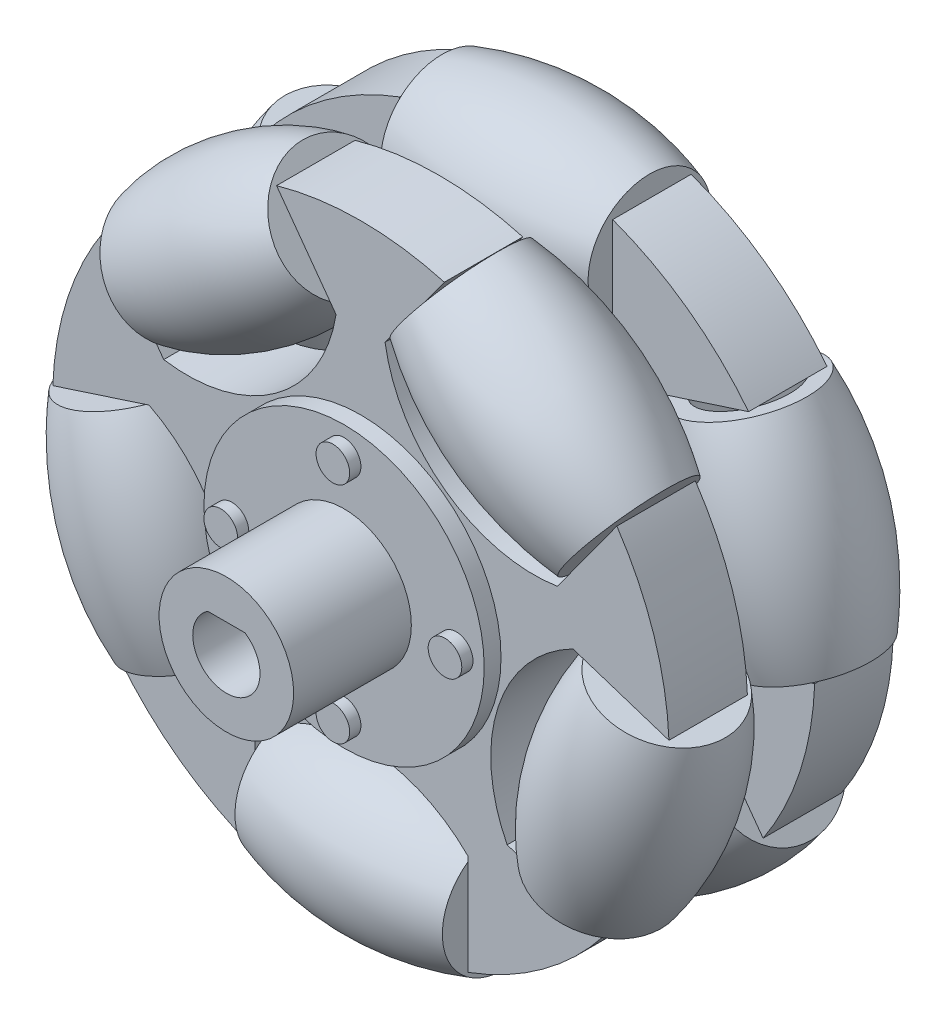
from build123d import *

# Parameters (mm, degrees)
BOSS_EXTRUDE2_DEPTH      = 3.5
BOSS_EXTRUDE5_DEPTH      = 3.5
BOSS_EXTRUDE6_DEPTH      = 5
BOSS_EXTRUDE6_DEPTH_BACK = 1
SKETCH3_30_R             = 12.5
SKETCH6_R                = 12.5
CUT_EXTRUDE3_DEPTH       = 2
BOSS_EXTRUDE9_DEPTH      = 6
BOSS_EXTRUDE9_DEPTH_BACK = 16
SKETCH3_33_R             = 1.5
SKETCH10_R               = 6
BOSS_EXTRUDE10_DEPTH     = 12
CUT_EXTRUDE4_DEPTH       = 51.813384178
CUT_EXTRUDE4_DEPTH_BACK  = 51.813384178
SKETCH11_R               = 6
CUT_EXTRUDE5_DEPTH       = 15


# Read off the part's stored shape, not the designer's step: moBlkMgr[Onmi_58mm_OK]
with BuildPart() as part:
    # Sketch1 → Revolve3 (revolve)
    with BuildSketch(Plane.XY, mode=Mode.PRIVATE) as revolve3_sk:
        with BuildLine():
            Line((27.488521747, -0.794463438), (28.998407922, -0.303871681))
            ThreePointArc((28.998407922, -0.303871681), (27.580638973, 8.961492837), (23.281593526, 17.29067387))
            Line((23.281593526, 17.29067387), (21.771707351, 16.800082113))
            ThreePointArc((21.771707351, 16.800082113), (26.028560776, 8.874909798), (27.5, 0))
            ThreePointArc((27.5, 0), (27.497130287, -0.397273176), (27.488521747, -0.794463438))
        make_face()
    revolve(revolve3_sk.sketch.rotate(Axis((18.064836163, 15.595646653, 0), (0.30901699437493513, -0.9510565162951576, 0)), 180), axis=Axis((18.064836163, 15.595646653, 0), (0.30901699437493513, -0.9510565162951576, 0)))



with BuildPart() as body_2:
    # Sketch1<6> → Revolve4 (revolve)
    with BuildSketch(Plane.XY, mode=Mode.PRIVATE) as revolve4_sk:
        with BuildLine():
            Line((-9.25, 27.485223303), (-9.25, 22.000000003))
            Line((-9.25, 22.000000003), (9.25, 22.000000003))
            Line((9.25, 22.000000003), (9.25, 27.485223303))
            ThreePointArc((9.25, 27.485223303), (0, 29), (-9.25, 27.485223303))
        make_face()
    revolve(revolve4_sk.sketch.rotate(Axis((-9.25, 22.000000003, 0), (1, 0, 0)), 90), axis=Axis((-9.25, 22.000000003, 0), (1, 0, 0)))


with BuildPart() as body_3:
    # Sketch1<7> → Revolve5 (revolve)
    with BuildSketch(Plane.XY, mode=Mode.PRIVATE) as revolve5_sk:
        with BuildLine():
            Line((-23.281593526, 17.29067387), (-18.064836163, 15.595646653))
            Line((-18.064836163, 15.595646653), (-23.781650559, -1.998898899))
            Line((-23.781650559, -1.998898899), (-28.998407922, -0.303871681))
            ThreePointArc((-28.998407922, -0.303871681), (-27.580638973, 8.961492837), (-23.281593526, 17.29067387))
        make_face()
    revolve(revolve5_sk.sketch.rotate(Axis((-23.781650559, -1.998898899, 0), (0.3090169943749596, 0.9510565162951496, 0)), 180), axis=Axis((-23.781650559, -1.998898899, 0), (0.3090169943749596, 0.9510565162951496, 0)))


with BuildPart() as body_4:
    # Sketch1<8> → Revolve6 (revolve)
    with BuildSketch(Plane.XY, mode=Mode.PRIVATE) as revolve6_sk:
        with BuildLine():
            Line((-23.638816111, -16.798999162), (-20.41468275, -12.361360295))
            Line((-20.41468275, -12.361360295), (-5.447868354, -23.235387462))
            Line((-5.447868354, -23.235387462), (-8.672001715, -27.67302633))
            ThreePointArc((-8.672001715, -27.67302633), (-17.045772316, -23.461492837), (-23.638816111, -16.798999162))
        make_face()
    revolve(revolve6_sk.sketch.rotate(Axis((-5.447868354, -23.235387462, 0), (-0.8090169943749399, 0.5877852522924835, 0)), 180), axis=Axis((-5.447868354, -23.235387462, 0), (-0.8090169943749399, 0.5877852522924835, 0)))


with BuildPart() as body_5:
    # Sketch1<9> → Revolve7 (revolve)
    with BuildSketch(Plane.XY, mode=Mode.PRIVATE) as revolve7_sk:
        with BuildLine():
            Line((8.672001715, -27.67302633), (5.447868354, -23.235387462))
            Line((5.447868354, -23.235387462), (20.41468275, -12.361360295))
            Line((20.41468275, -12.361360295), (23.638816111, -16.798999162))
            ThreePointArc((23.638816111, -16.798999162), (17.045772316, -23.461492837), (8.672001715, -27.67302633))
        make_face()
    revolve(revolve7_sk.sketch.rotate(Axis((20.41468275, -12.361360295, 0), (-0.809016994374955, -0.5877852522924628, 0)), 180), axis=Axis((20.41468275, -12.361360295, 0), (-0.809016994374955, -0.5877852522924628, 0)))


with BuildPart() as part_1:
    add(part.part)

    add(body_2.part)  # Boss-Extrude2 merges body 2

    add(body_3.part)  # Boss-Extrude2 merges body 3

    add(body_4.part)  # Boss-Extrude2 merges body 4

    add(body_5.part)  # Boss-Extrude2 merges body 5
    # Sketch1<10> → Boss-Extrude2 (add, symmetric)
    with BuildSketch(Plane.XY):
        with BuildLine():
            ThreePointArc((22.87697608, -15.26086385), (26.166457463, -8.459698804), (27.48107512, -1.020054043))
            Line((27.48107512, -1.020054043), (18.895132644, -3.809795864))
            ThreePointArc((18.895132644, -3.809795864), (12.217036375, 4.009250255), (13.023809751, 14.260277946))
            Line((13.023809751, 14.260277946), (21.583318397, 17.041430895))
            ThreePointArc((21.583318397, 17.041430895), (16.131531712, 22.271589181), (9.46224828, 25.820841533))
            Line((9.46224828, 25.820841533), (9.46224828, 16.79304736))
            ThreePointArc((9.46224828, 16.79304736), (-0.03775172, 12.858018518), (-9.53775172, 16.79304736))
            Line((-9.53775172, 16.79304736), (-9.53775172, 25.79304736))
            ThreePointArc((-9.53775172, 25.79304736), (-16.196622574, 22.224297901), (-21.633084073, 16.978211728))
            Line((-21.633084073, 16.978211728), (-13.047141597, 14.188469907))
            ThreePointArc((-13.047141597, 14.188469907), (-12.240368221, 3.937442217), (-18.91846449, -3.881603902))
            Line((-18.91846449, -3.881603902), (-27.477973137, -1.100450953))
            ThreePointArc((-27.477973137, -1.100450953), (-26.141594966, -8.536217702), (-22.832229519, -15.327729617))
            Line((-22.832229519, -15.327729617), (-17.525825243, -8.024090709))
            ThreePointArc((-17.525825243, -8.024090709), (-7.527211875, -10.424545399), (-2.15450235, -19.192010503))
            Line((-2.15450235, -19.192010503), (-7.44456962, -26.473163452))
            ThreePointArc((-7.44456962, -26.473163452), (0.040228365, -27.499970576), (7.521990192, -26.451269602))
            Line((7.521990192, -26.451269602), (2.215585916, -19.147630694))
            ThreePointArc((2.215585916, -19.147630694), (7.588295441, -10.380165591), (17.586908809, -7.979710901))
            Line((17.586908809, -7.979710901), (22.87697608, -15.26086385))
        make_face()
    extrude(amount=BOSS_EXTRUDE2_DEPTH, both=True)

    # Sketch6 → Cut-Extrude3 (cut)
    with BuildSketch(Plane(origin=(0, 0, -3.5), x_dir=(-1, 0, 0), z_dir=(0, 0, -1))):
        with Locations(Location((0, 0, 0), (0, 0, 180))):
            Circle(SKETCH6_R)
    extrude(amount=-CUT_EXTRUDE3_DEPTH, mode=Mode.SUBTRACT)



with BuildPart() as body_2_2:
    # Sketch3 → Boss-Extrude5 (new, symmetric)
    with BuildSketch(Plane.XY.offset(13)):
        with BuildLine():
            Line((-22.87697608, 15.26086385), (-17.586908809, 7.979710901))
            ThreePointArc((-17.586908809, 7.979710901), (-7.588295441, 10.380165591), (-2.215585916, 19.147630694))
            Line((-2.215585916, 19.147630694), (-7.521990192, 26.451269602))
            ThreePointArc((-7.521990192, 26.451269602), (-0.040228365, 27.499970576), (7.44456962, 26.473163452))
            Line((7.44456962, 26.473163452), (2.15450235, 19.192010503))
            ThreePointArc((2.15450235, 19.192010503), (7.527211875, 10.424545399), (17.525825243, 8.024090709))
            Line((17.525825243, 8.024090709), (22.832229519, 15.327729617))
            ThreePointArc((22.832229519, 15.327729617), (26.141594966, 8.536217702), (27.477973137, 1.100450953))
            Line((27.477973137, 1.100450953), (18.91846449, 3.881603902))
            ThreePointArc((18.91846449, 3.881603902), (12.240368221, -3.937442217), (13.047141597, -14.188469907))
            Line((13.047141597, -14.188469907), (21.633084073, -16.978211728))
            ThreePointArc((21.633084073, -16.978211728), (16.196622574, -22.224297901), (9.53775172, -25.79304736))
            Line((9.53775172, -25.79304736), (9.53775172, -16.79304736))
            ThreePointArc((9.53775172, -16.79304736), (0.03775172, -12.858018518), (-9.46224828, -16.79304736))
            Line((-9.46224828, -16.79304736), (-9.46224828, -25.820841533))
            ThreePointArc((-9.46224828, -25.820841533), (-16.131531712, -22.271589181), (-21.583318397, -17.041430895))
            Line((-21.583318397, -17.041430895), (-13.023809751, -14.260277946))
            ThreePointArc((-13.023809751, -14.260277946), (-12.217036375, -4.009250255), (-18.895132644, 3.809795864))
            Line((-18.895132644, 3.809795864), (-27.48107512, 1.020054043))
            ThreePointArc((-27.48107512, 1.020054043), (-26.166457463, 8.459698804), (-22.87697608, 15.26086385))
        make_face()
    extrude(amount=BOSS_EXTRUDE5_DEPTH, both=True)

    # Sketch3<25> → Revolve14 (revolve)
    with BuildSketch(Plane.XY.offset(13), mode=Mode.PRIVATE) as revolve14_sk:
        with BuildLine():
            Line((23.638816111, 16.798999162), (20.41468275, 12.361360295))
            Line((20.41468275, 12.361360295), (5.447868354, 23.235387462))
            Line((5.447868354, 23.235387462), (8.672001715, 27.67302633))
            ThreePointArc((8.672001715, 27.67302633), (17.045772316, 23.461492837), (23.638816111, 16.798999162))
        make_face()
    revolve(revolve14_sk.sketch.rotate(Axis((5.447868354, 23.235387462, 13), (0.80901699437494, -0.5877852522924834, 0)), 170.793375583), axis=Axis((5.447868354, 23.235387462, 13), (0.80901699437494, -0.5877852522924834, 0)))

    # Sketch3<26> → Revolve15 (revolve)
    with BuildSketch(Plane.XY.offset(13), mode=Mode.PRIVATE) as revolve15_sk:
        with BuildLine():
            Line((23.281593526, -17.29067387), (18.064836163, -15.595646653))
            Line((18.064836163, -15.595646653), (23.781650559, 1.998898899))
            Line((23.781650559, 1.998898899), (28.998407922, 0.303871681))
            ThreePointArc((28.998407922, 0.303871681), (27.580638973, -8.961492837), (23.281593526, -17.29067387))
        make_face()
    revolve(revolve15_sk.sketch.rotate(Axis((23.781650559, 1.998898899, 13), (-0.3090169943749462, -0.951056516295154, 0)), 170.793375583), axis=Axis((23.781650559, 1.998898899, 13), (-0.3090169943749462, -0.951056516295154, 0)))

    # Sketch3<27> → Revolve16 (revolve)
    with BuildSketch(Plane.XY.offset(13), mode=Mode.PRIVATE) as revolve16_sk:
        with BuildLine():
            Line((-23.638816111, 16.798999162), (-20.41468275, 12.361360295))
            Line((-20.41468275, 12.361360295), (-5.447868354, 23.235387462))
            Line((-5.447868354, 23.235387462), (-8.672001715, 27.67302633))
            ThreePointArc((-8.672001715, 27.67302633), (-17.045772316, 23.461492837), (-23.638816111, 16.798999162))
        make_face()
    revolve(revolve16_sk.sketch.rotate(Axis((-20.41468275, 12.361360295, 13), (0.8090169943749468, 0.5877852522924741, 0)), 170.793375583), axis=Axis((-20.41468275, 12.361360295, 13), (0.8090169943749468, 0.5877852522924741, 0)))

    # Sketch3<28> → Revolve17 (revolve)
    with BuildSketch(Plane.XY.offset(13), mode=Mode.PRIVATE) as revolve17_sk:
        with BuildLine():
            Line((-28.998407922, 0.303871681), (-23.781650559, 1.998898899))
            Line((-23.781650559, 1.998898899), (-18.064836163, -15.595646653))
            Line((-18.064836163, -15.595646653), (-23.281593526, -17.29067387))
            ThreePointArc((-23.281593526, -17.29067387), (-27.580638973, -8.961492837), (-28.998407922, 0.303871681))
        make_face()
    revolve(revolve17_sk.sketch.rotate(Axis((-18.064836163, -15.595646653, 13), (-0.3090169943749486, 0.9510565162951532, 0)), 170.793375583), axis=Axis((-18.064836163, -15.595646653, 13), (-0.3090169943749486, 0.9510565162951532, 0)))

    # Sketch3<29> → Revolve18 (revolve)
    with BuildSketch(Plane.XY.offset(13), mode=Mode.PRIVATE) as revolve18_sk:
        with BuildLine():
            Line((-9.25, -27.485223303), (-9.25, -22.000000003))
            Line((-9.25, -22.000000003), (9.25, -22.000000003))
            Line((9.25, -22.000000003), (9.25, -27.485223303))
            ThreePointArc((9.25, -27.485223303), (0, -29), (-9.25, -27.485223303))
        make_face()
    revolve(revolve18_sk.sketch.rotate(Axis((9.25, -22.000000003, 13), (-1, 0, 0)), 189.206624435), axis=Axis((9.25, -22.000000003, 13), (-1, 0, 0)))

    # Sketch3<30> → Boss-Extrude6 (add, two sides: drawn at the far end of the back side and taken through both)
    with BuildSketch(Plane.XY.offset(13).offset(-BOSS_EXTRUDE6_DEPTH_BACK)):
        Circle(SKETCH3_30_R)
    extrude(amount=BOSS_EXTRUDE6_DEPTH + BOSS_EXTRUDE6_DEPTH_BACK)


with BuildPart() as part_2:
    add(part_1.part)

    add(body_2_2.part)  # Boss-Extrude9 merges body 2 2
    # Sketch3<33> → Boss-Extrude9 (add, two sides: drawn at the far end of the back side and taken through both)
    with BuildSketch(Plane.XY.offset(13).offset(-BOSS_EXTRUDE9_DEPTH_BACK)):
        with Locations((0, 10)):
            Circle(SKETCH3_33_R)
        with Locations((10, 0)):
            Circle(SKETCH3_33_R)
        with Locations((0, -10)):
            Circle(SKETCH3_33_R)
        with Locations((-10, 0)):
            Circle(SKETCH3_33_R)
    extrude(amount=BOSS_EXTRUDE9_DEPTH + BOSS_EXTRUDE9_DEPTH_BACK)

    # Sketch10 → Boss-Extrude10 (add)
    with BuildSketch(Plane.XY.offset(16.5)):
        Circle(SKETCH10_R)
    extrude(amount=BOSS_EXTRUDE10_DEPTH)

    # Sketch9 → Cut-Extrude4 (cut, two sides: drawn at the far end of the back side and taken through both)
    with BuildSketch(Plane(origin=(0, 0, -1.5), x_dir=(-1, 0, 0), z_dir=(0, 0, -1)).offset(-CUT_EXTRUDE4_DEPTH_BACK)):
        with BuildLine():
            Line((1.658312395, 2.5), (-1.658312395, 2.5))
            ThreePointArc((-1.658312395, 2.5), (0, -3), (1.658312395, 2.5))
        make_face()
    extrude(amount=CUT_EXTRUDE4_DEPTH + CUT_EXTRUDE4_DEPTH_BACK, mode=Mode.SUBTRACT)

    # Sketch11 → Cut-Extrude5 (cut)
    with BuildSketch(Plane(origin=(0, 0, -1.5), x_dir=(-1, 0, 0), z_dir=(0, 0, -1))):
        with Locations(Location((0, 0, 0), (0, 0, 180))):
            Circle(SKETCH11_R)
    extrude(amount=-CUT_EXTRUDE5_DEPTH, mode=Mode.SUBTRACT)


solid = part_2.part
